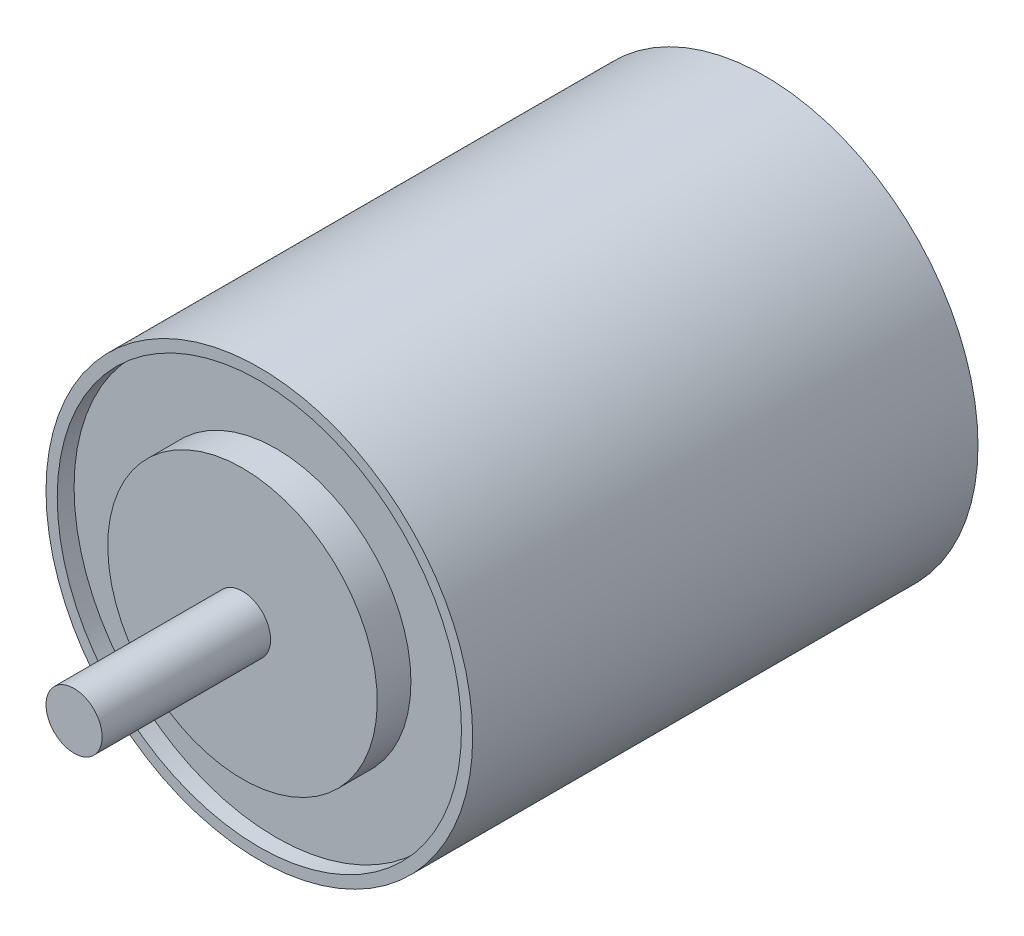
from build123d import *

# Parameters (mm, degrees)
SKETCH7_R           = 120
BOSS_EXTRUDE1_DEPTH = 30
SKETCH8_R           = 25
BOSS_EXTRUDE2_DEPTH = 60
BOSS_EXTRUDE3_START = 150
SKETCH11_R          = 25
BOSS_EXTRUDE3_DEPTH = 150


# Read off the part's stored shape, not the designer's step: Revolve-Thin1
with BuildPart() as part:
    # Revolve-Thin1 outline → Revolve-Thin1 (revolve)
    with BuildSketch(Plane.XZ.offset(190)):
        Polygon((180, 309.593023256), (0, 309.593023256), (0, 299.593023256), (180, 299.593023256), (180, -100.406976744), (0, -100.406976744), (0, -110.406976744), (180, -110.406976744), (180, -125.406976744), (190, -125.406976744), (190, 324.593023256), (180, 324.593023256), align=None)
    revolve(axis=Axis((0, -190, 0), (0, 0, 1)))

    # Sketch7 → Boss-Extrude1 (add)
    with BuildSketch(Plane(origin=(0, 0, -110.406976744), x_dir=(-1, 0, 0), z_dir=(0, 0, -1))):
        with Locations(Location((0, -190, 0), (0, 0, 90))):
            Circle(SKETCH7_R)
    boss_extrude1 = extrude(amount=BOSS_EXTRUDE1_DEPTH)

    # Mirror1: Boss-Extrude1 across plane
    add(boss_extrude1.mirror(Plane(origin=(0, 0, 99.593023256), x_dir=(1, 0, 0), z_dir=(0, 0, -1))))

    # Sketch8 → Boss-Extrude2 (add)
    with BuildSketch(Plane(origin=(0, 0, -140.406976744), x_dir=(-1, 0, 0), z_dir=(0, 0, -1))):
        with Locations(Location((0, -190, 0), (0, 0, 90))):
            Circle(SKETCH8_R)
    extrude(amount=BOSS_EXTRUDE2_DEPTH)

    # Sketch11 → Boss-Extrude3 (add)
    with BuildSketch(Plane.XY.offset(339.593023256).offset(BOSS_EXTRUDE3_START)):
        with Locations(Location((0, -190, 0), (0, 0, 90))):
            Circle(SKETCH11_R)
    extrude(amount=-BOSS_EXTRUDE3_DEPTH)


solid = part.part
